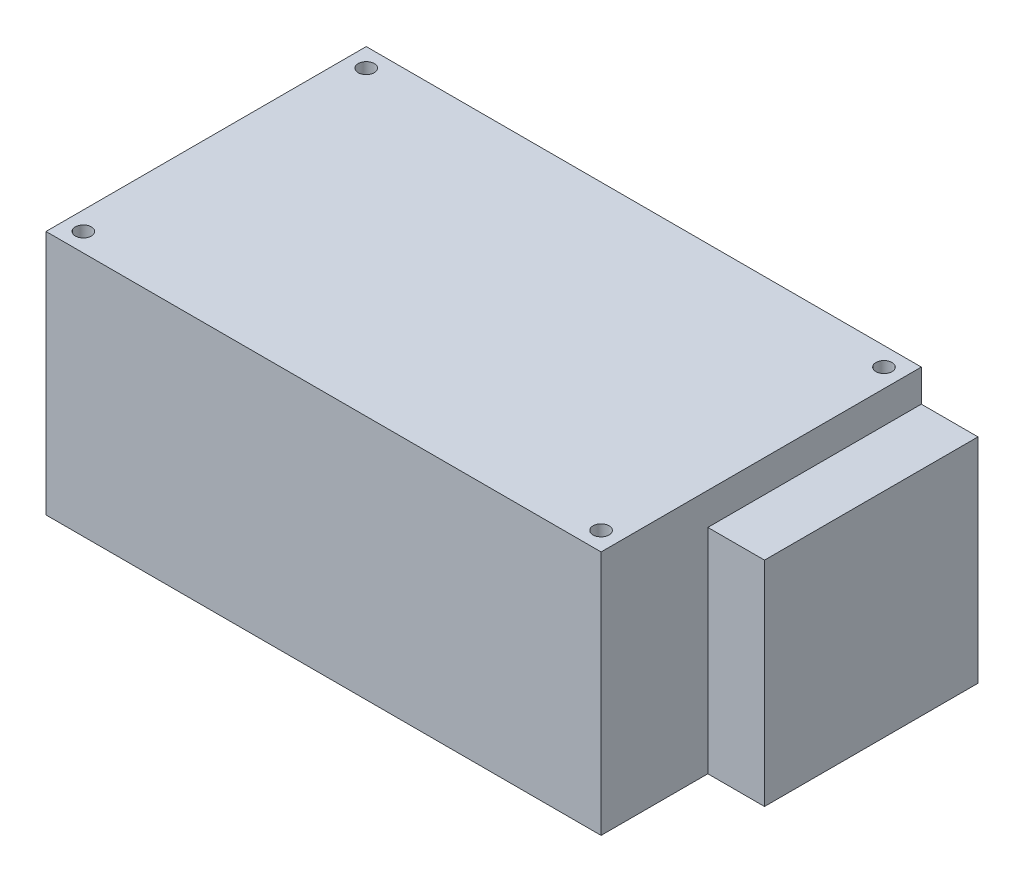
from build123d import *

# Parameters (mm, degrees)
SKETCH1_W           = 104
SKETCH1_H           = 60
BOSS_EXTRUDE1_DEPTH = 46
SKETCH2_R           = 1.5
CUT_EXTRUDE1_DEPTH  = 129.576825284
SKETCH3_W           = 40
SKETCH3_H           = 39.9796
BOSS_EXTRUDE2_DEPTH = 10.6172


with BuildPart() as part:
    # Sketch1 → Boss-Extrude1 (new body)
    with BuildSketch(Plane(origin=(0, 0, 0), x_dir=(1, 0, 0), z_dir=(0, 1, 0))):
        with Locations((52, 30)):
            Rectangle(SKETCH1_W, SKETCH1_H)
    extrude(amount=BOSS_EXTRUDE1_DEPTH)

    # Sketch2 → Cut-Extrude1 (cut, through all)
    with BuildSketch(Plane(origin=(0, 46, 0), x_dir=(1, 0, 0), z_dir=(0, 1, 0))):
        with Locations((3.5, 56.5)):
            Circle(SKETCH2_R)
        with Locations((100.5, 56.5)):
            Circle(SKETCH2_R)
        with Locations((100.5, 3.5)):
            Circle(SKETCH2_R)
        with Locations((3.5, 3.5)):
            Circle(SKETCH2_R)
    extrude(amount=-CUT_EXTRUDE1_DEPTH, mode=Mode.SUBTRACT)

    # Sketch3 → Boss-Extrude2 (add)
    with BuildSketch(Plane(origin=(104, 0, 0), x_dir=(0, 0, -1), z_dir=(1, 0, 0))):
        with Locations((40, 19.9898)):
            Rectangle(SKETCH3_W, SKETCH3_H)
    extrude(amount=BOSS_EXTRUDE2_DEPTH)


solid = part.part
